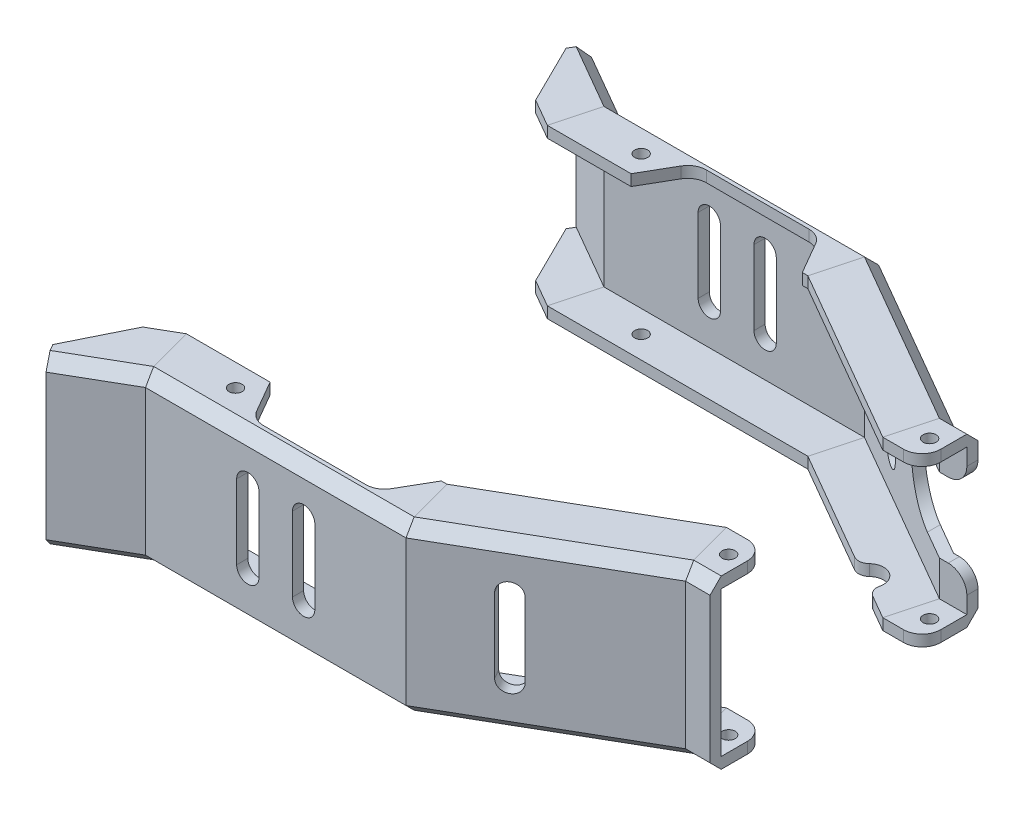
from build123d import *

# Parameters (mm, degrees)
CUT_EXTRUDE1_DEPTH         = 112.966111578
CUT_EXTRUDE3_DEPTH         = 5
CUT_EXTRUDE4_DEPTH         = 10
CHAMFER1_SIZE              = 3
CUT_EXTRUDE6_DEPTH         = 3
F_3_5_3_5_DIAMETER_HOLE1_D = 3.5
CUT_EXTRUDE9_DEPTH         = 10
CUT_EXTRUDE7_DEPTH         = 143.735444435
CUT_EXTRUDE7_DEPTH_BACK    = 5
FILLET1_R                  = 3
FILLET2_R                  = 3
FILLET3_R                  = 5
FILLET4_R                  = 5
FILLET5_R                  = 5
FILLET6_R                  = 5
FILLET7_R                  = 5


with BuildPart() as part:
    # Sweep8: sweep along a path in Sketch6
    with BuildLine(Plane(origin=(0, 0, 0), x_dir=(1, 0, 0), z_dir=(0, 1, 0))) as sweep8_path:
        Line((-87.320508076, -10), (-70, 0))
        Line((-70, 0), (0, 0))
        Line((0, 0), (47.631397208, 27.5))
        Line((47.631397208, 27.5), (54.631397208, 27.5))
    # Sketch7 → Sweep8 (sweep)
    with BuildSketch(Plane(origin=(0, 0, 0), x_dir=(0, 0, -1), z_dir=(1, 0, 0))):
        Polygon((-1.607142857, -22.5), (-1.607142857, 22.5), (13.392857143, 22.5), (13.392857143, 19.5), (1.392857143, 19.5), (1.392857143, -19.5), (13.392857143, -19.5), (13.392857143, -22.5), align=None)
    sweep(path=sweep8_path.line, transition=Transition.RIGHT)

    # Sketch8 → Cut-Extrude1 (cut, through all)
    with BuildSketch(Plane(origin=(0, 22.5, 0), x_dir=(1, 0, 0), z_dir=(0, 1, 0))):
        Polygon((-89.016936647, -7.061699523), (-94.016936647, 1.598554515), (-81.02655559, 9.098554515), align=None)
    extrude(amount=-CUT_EXTRUDE1_DEPTH, mode=Mode.SUBTRACT)

    # Sketch10 → Cut-Extrude3 (cut)
    with BuildSketch(Plane(origin=(0, 22.5, 0), x_dir=(1, 0, 0), z_dir=(0, 1, 0))):
        Polygon((-51.088605256, 13.392857143), (-5.088605256, 13.392857143), (-11.439458217, 2.392857143), (-44.737752295, 2.392857143), align=None)
    extrude(amount=-CUT_EXTRUDE3_DEPTH, mode=Mode.SUBTRACT)

    # Sketch11 → Cut-Extrude4 (cut)
    with BuildSketch(Plane.XY.offset(1.607142857)):
        with BuildLine():
            Line((-45.069367369, -9.5), (-45.069367369, 10.5))
            ThreePointArc((-45.069367369, 10.5), (-42.069367369, 13.5), (-39.069367369, 10.5))
            Line((-39.069367369, 10.5), (-39.069367369, -9.5))
            ThreePointArc((-39.069367369, -9.5), (-42.069367369, -12.5), (-45.069367369, -9.5))
        make_face()
        with BuildLine():
            Line((-24.069367369, -9.5), (-24.069367369, 10.5))
            ThreePointArc((-24.069367369, 10.5), (-27.069367369, 13.5), (-30.069367369, 10.5))
            Line((-30.069367369, 10.5), (-30.069367369, -9.5))
            ThreePointArc((-30.069367369, -9.5), (-27.069367369, -12.5), (-24.069367369, -9.5))
        make_face()
    extrude(amount=-CUT_EXTRUDE4_DEPTH, mode=Mode.SUBTRACT)

    # Chamfer1
    chamfer1_edges = [part.edges().sort_by_distance(p)[0] for p in [
        (-78.043152008, -22.5, 6.499484699),
        (-34.569367369, -22.5, 1.607142857),
        (24.246331235, -22.5, -12.142857143),
        (-78.043152008, 22.5, 6.499484699),
        (-34.569367369, 22.5, 1.607142857),
        (24.246331235, 22.5, -12.142857143),
        (51.346713523, -22.5, -25.892857143),
        (51.346713523, 22.5, -25.892857143),
    ]]
    chamfer(chamfer1_edges, length=CHAMFER1_SIZE)

    # Sketch14 → Cut-Extrude6 (cut)
    with BuildSketch(Plane(origin=(0.803571429, 0, 1.391826542), x_dir=(0.8660254037844379, 0, -0.5000000000000014), z_dir=(0.5000000000000014, 0, 0.8660254037844379))):
        with BuildLine():
            Line((17, -10), (17, 10))
            ThreePointArc((17, 10), (20, 13), (23, 10))
            Line((23, 10), (23, -10))
            ThreePointArc((23, -10), (20, -13), (17, -10))
        make_face()
    extrude(amount=-CUT_EXTRUDE6_DEPTH, mode=Mode.SUBTRACT)

    # Ø3.5 (3.5) Diameter Hole1 (through all)
    with Locations(Plane(origin=(0, -22.5, 0), x_dir=(-1, 0, 0), z_dir=(0, -1, 0))):
        with Locations((54.368602792, 7.392857143), (-50.631397208, 34.892857143)):
            Hole(F_3_5_3_5_DIAMETER_HOLE1_D / 2)

    # Sketch22 → Cut-Extrude9 (cut)
    with BuildSketch(Plane.XZ.offset(22.5)):
        with BuildLine():
            Line((28.954334684, -31.026831739), (28.454334684, -31.892857143))
            Line((28.454334684, -31.892857143), (35.382537915, -35.892857143))
            Line((35.382537915, -35.892857143), (35.882537915, -35.026831739))
            ThreePointArc((35.882537915, -35.026831739), (34.418436299, -29.562730124), (28.954334684, -31.026831739))
        make_face()
    extrude(amount=-CUT_EXTRUDE9_DEPTH, mode=Mode.SUBTRACT)


with BuildPart() as body_2:
    # Mirror2: mirrored copy
    add(part.part.mirror(Plane(origin=(0, 0, -61.892857143), x_dir=(1, 0, 0), z_dir=(0, 0, -1))))

    # Sketch20 → Cut-Extrude7 (cut, two sides: drawn at the far end of the back side and taken through both)
    with BuildSketch(Plane(origin=(0, 0, -97.892857143), x_dir=(-1, 0, 0), z_dir=(0, 0, -1)).offset(-CUT_EXTRUDE7_DEPTH_BACK)):
        with BuildLine():
            ThreePointArc((-39.631397208, -10), (-29.631397208, 0), (-39.631397208, 10))
            Line((-39.631397208, 10), (-54.631397208, 10))
            Line((-54.631397208, 10), (-54.631397208, -10))
            Line((-54.631397208, -10), (-39.631397208, -10))
        make_face()
    extrude(amount=CUT_EXTRUDE7_DEPTH + CUT_EXTRUDE7_DEPTH_BACK, mode=Mode.SUBTRACT)

    # Fillet2
    fillet2_edges = [body_2.edges().sort_by_distance(p)[0] for p in [
        (28.454334684, -21, -91.892857143),
        (35.382537915, -21, -87.892857143),
    ]]
    fillet(fillet2_edges, radius=FILLET2_R)

    # Fillet4
    fillet4_edges = [body_2.edges().sort_by_distance(p)[0] for p in [
        (54.631397208, 21, -82.892857143),
        (54.631397208, -21, -82.892857143),
    ]]
    fillet(fillet4_edges, radius=FILLET4_R)

    # Fillet5
    fillet5_edges = [body_2.edges().sort_by_distance(p)[0] for p in [
        (54.631397208, 10, -96.392857143),
        (54.631397208, -10, -96.392857143),
    ]]
    fillet(fillet5_edges, radius=FILLET5_R)

    # Fillet7
    fillet7_edges = [body_2.edges().sort_by_distance(p)[0] for p in [
        (-44.737752295, 21, -121.392857143),
        (-11.439458217, 21, -121.392857143),
    ]]
    fillet(fillet7_edges, radius=FILLET7_R)


with BuildPart() as part_1:
    add(part.part)

    # Fillet1
    fillet1_edges = [part_1.edges().sort_by_distance(p)[0] for p in [
        (28.454334684, -21, -31.892857143),
        (35.382537915, -21, -35.892857143),
    ]]
    fillet(fillet1_edges, radius=FILLET1_R)

    # Fillet3
    fillet3_edges = [part_1.edges().sort_by_distance(p)[0] for p in [
        (54.631397208, 21, -40.892857143),
        (54.631397208, -21, -40.892857143),
    ]]
    fillet(fillet3_edges, radius=FILLET3_R)

    # Fillet6
    fillet6_edges = [part_1.edges().sort_by_distance(p)[0] for p in [
        (-44.737752295, 21, -2.392857143),
        (-11.439458217, 21, -2.392857143),
    ]]
    fillet(fillet6_edges, radius=FILLET6_R)


solid = Compound([body_2.part, part_1.part])
